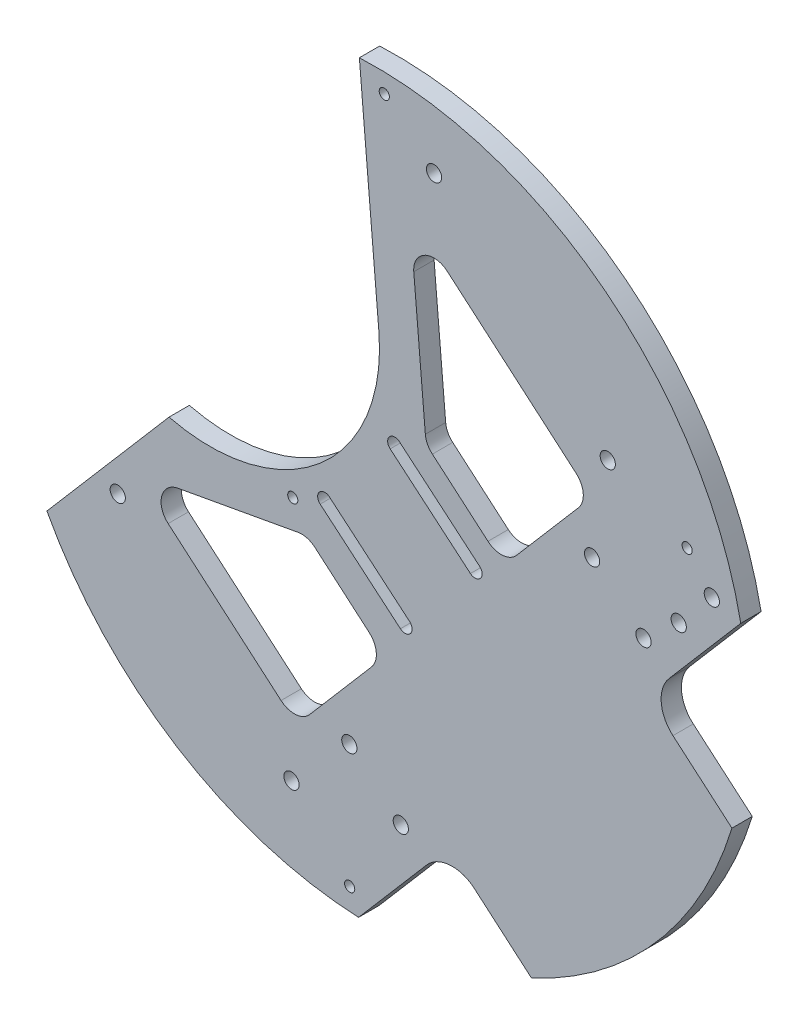
from build123d import *

# Parameters (mm, degrees)
SKETCH1_R                     = 2.25
BOSS_EXTRUDE1_DEPTH           = 6
CUT_EXTRUDE1_DEPTH            = 10
F_4_5_4_5_DIAMETER_HOLE_D     = 4.5
F_4_5_4_5_DIAMETER_HOLE_DEPTH = 10
F_4_5_4_5_DIAMETER_HOLE_TIP   = 1.351936393
F_3_0MM_DOWEL_HOLE1_D         = 3
SKETCH7_R                     = 2.25
CUT_EXTRUDE2_DEPTH            = 10


with BuildPart() as part:
    # Sketch1 → Boss-Extrude1 (new body)
    with BuildSketch(Plane.XY):
        with BuildLine():
            Line((-65.062292504, 1.761474955), (-29.013741643, 43.790275256))
            ThreePointArc((-29.013741643, 43.790275256), (15.531598506, 54.252169724), (32.910590961, 96.580755646))
            Line((32.910590961, 96.580755646), (27.145897983, 163.700277374))
            ThreePointArc((27.145897983, 163.700277374), (127.439625673, -0.628257917), (-65.062292504, 1.761474955))
        make_face()
        with Locations((-44.147760432, 16.623194411)):
            Circle(SKETCH1_R, mode=Mode.SUBTRACT)
        with Locations((7.121926815, -31.036213575)):
            Circle(SKETCH1_R, mode=Mode.SUBTRACT)
        with Locations((100.448444849, 97.528310755)):
            Circle(SKETCH1_R, mode=Mode.SUBTRACT)
        with Locations((49.178757602, 145.187718741)):
            Circle(SKETCH1_R, mode=Mode.SUBTRACT)
    extrude(amount=BOSS_EXTRUDE1_DEPTH)

    # Sketch2 → Cut-Extrude1 (cut)
    with BuildSketch(Plane.XY.offset(6)):
        with BuildLine():
            Line((59.916105479, 48.280305382), (36.239073473, 68.290256792))
            ThreePointArc((36.239073473, 68.290256792), (35.990658336, 71.249697604), (38.950099148, 71.498112741))
            Line((38.950099148, 71.498112741), (62.627131153, 51.488161331))
            ThreePointArc((62.627131153, 51.488161331), (62.87554629, 48.528720519), (59.916105479, 48.280305382))
        make_face()
        with BuildLine():
            Line((39.260671766, 23.839498151), (15.58363976, 43.84944956))
            ThreePointArc((15.58363976, 43.84944956), (15.335224623, 46.808890372), (18.294665435, 47.057305509))
            Line((18.294665435, 47.057305509), (41.97169744, 27.0473541))
            ThreePointArc((41.97169744, 27.0473541), (42.220112578, 24.087913288), (39.260671766, 23.839498151))
        make_face()
    extrude(amount=-CUT_EXTRUDE1_DEPTH, mode=Mode.SUBTRACT)

    # Ø4.5 (4.5) Diameter Hole
    with Locations(Plane(origin=(207.146976376, -96.500272002, 6), x_dir=(-0.650906698329443, -0.7591577372785339, 0), z_dir=(0, 0, 1))):
        with Locations((80.500098125, -194.461558154), (77.690872648, -264.405165812), (-80.656736457, -277.239127607), (-77.84751098, -207.295519949)):
            Hole(F_4_5_4_5_DIAMETER_HOLE_D / 2, depth=F_4_5_4_5_DIAMETER_HOLE_DEPTH)
            with Locations((0, 0, -(F_4_5_4_5_DIAMETER_HOLE_DEPTH + F_4_5_4_5_DIAMETER_HOLE_TIP / 2))):  # 118° drill point
                Cone(0, F_4_5_4_5_DIAMETER_HOLE_D / 2, F_4_5_4_5_DIAMETER_HOLE_TIP, mode=Mode.SUBTRACT)

    # Ø3.0mm Dowel Hole1 (through all)
    with Locations(Plane(origin=(207.146976376, -96.500272002, 6), x_dir=(-0.650906698329443, -0.7591577372785339, 0), z_dir=(0, 0, 1))):
        with Locations((-80.915811264, -296.794954316), (-84.945199209, -182.518931257), (25.216324899, -241.36407945), (83.328606401, -169.42446636)):
            Hole(F_3_0MM_DOWEL_HOLE1_D / 2)

    # Sketch7 → Cut-Extrude2 (cut)
    with BuildSketch(Plane.XY.offset(6)):
        with Locations((39.373624561, -26.202338118)):
            Circle(SKETCH7_R)
        with Locations((111.001453393, 57.337776928)):
            Circle(SKETCH7_R)
        with Locations((24.190469816, -13.184204151)):
            Circle(SKETCH7_R)
        with Locations((95.818298648, 70.355910894)):
            Circle(SKETCH7_R)
        with Locations((121.391067307, 66.382630522)):
            Circle(SKETCH7_R)
        with Locations((131.154667782, 77.769996581)):
            Circle(SKETCH7_R)
        with BuildLine():
            Line((43.19827036, 117.032036303), (46.61785663, 77.217080695))
            ThreePointArc((46.61785663, 77.217080695), (47.256933147, 74.992633289), (48.690408404, 73.175565944))
            Line((48.690408404, 73.175565944), (65.097959227, 59.107626951))
            ThreePointArc((65.097959227, 59.107626951), (69.462669679, 57.680176629), (73.55834584, 59.757133185))
            Line((73.55834584, 59.757133185), (91.783733394, 81.013549829))
            ThreePointArc((91.783733394, 81.013549829), (93.211183716, 85.378260281), (91.13422716, 89.473936442))
            Line((91.13422716, 89.473936442), (53.081702513, 122.100414399))
            ThreePointArc((53.081702513, 122.100414399), (46.438383246, 122.884383423), (43.19827036, 117.032036303))
        make_face()
        with BuildLine():
            Line((139.699120531, 75.444912834), (118.593030766, 50.828709945))
            ThreePointArc((118.593030766, 50.828709945), (116.213946896, 43.554192524), (119.675541156, 36.728065588))
            Line((119.675541156, 36.728065588), (137.090677396, 21.796216416))
            Line((137.090677396, 21.796216416), (157.17525168, 45.221017553))
            Line((157.17525168, 45.221017553), (139.699120531, 75.444912834))
        make_face()
        with BuildLine():
            Line((26.921390512, -56.088664184), (46.965201934, -32.711405101))
            ThreePointArc((46.965201934, -32.711405101), (53.79132887, -29.249810841), (61.06584629, -31.628894712))
            Line((61.06584629, -31.628894712), (77.925194843, -46.084207967))
            Line((77.925194843, -46.084207967), (19.343591994, -114.408404322))
            Line((19.343591994, -114.408404322), (26.921390512, -56.088664184))
        make_face()
        with BuildLine():
            Line((30.070851257, 18.255228139), (14.019964002, 32.017361507))
            ThreePointArc((14.019964002, 32.017361507), (11.682395321, 33.253941561), (9.040252026, 33.365460072))
            Line((9.040252026, 33.365460072), (-26.444882579, 26.907660916))
            ThreePointArc((-26.444882579, 26.907660916), (-31.162137269, 22.572487437), (-29.276050982, 16.449669504))
            Line((-29.276050982, 16.449669504), (4.034583324, -12.111081352))
            ThreePointArc((4.034583324, -12.111081352), (8.399293776, -13.538531675), (12.494969937, -11.461575119))
            Line((12.494969937, -11.461575119), (30.720357491, 9.794841525))
            ThreePointArc((30.720357491, 9.794841525), (32.147807813, 14.159551977), (30.070851257, 18.255228139))
        make_face()
    extrude(amount=-CUT_EXTRUDE2_DEPTH, mode=Mode.SUBTRACT)


solid = part.part
